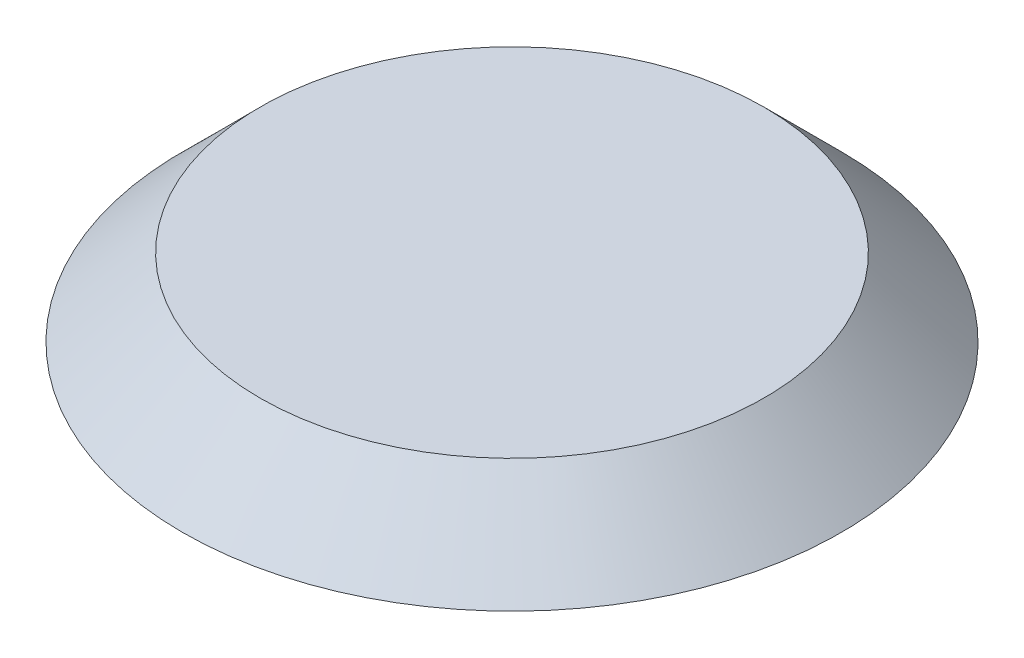
from build123d import *

# Parameters (mm, degrees)
SKETCH1_R           = 8.5
BOSS_EXTRUDE1_DEPTH = 2
CHAMFER1_SIZE       = 2
SKETCH2_R           = 0.8
BOSS_EXTRUDE2_DEPTH = 0.4


with BuildPart() as part:
    # Sketch1 → Boss-Extrude1 (new body)
    with BuildSketch(Plane(origin=(0, 0, 0), x_dir=(1, 0, 0), z_dir=(0, 1, 0))):
        with Locations(Location((0, 0, 0), (0, 0, 270))):
            Circle(SKETCH1_R)
    extrude(amount=BOSS_EXTRUDE1_DEPTH)

    # Chamfer1
    chamfer1_edges = [part.edges().sort_by_distance(p)[0] for p in [
        (0, 2, -8.5),
    ]]
    chamfer(chamfer1_edges, length=CHAMFER1_SIZE - 0.0001)  # a hair under: the kernel refuses the full size

    # Sketch2 → Boss-Extrude2 (add)
    with BuildSketch(Plane(origin=(0, 0, 0), x_dir=(-1, 0, 0), z_dir=(0, -1, 0))):
        with Locations(Location((0, 0, 0), (0, 0, 270))):
            Circle(SKETCH2_R)
    extrude(amount=BOSS_EXTRUDE2_DEPTH)


solid = part.part
